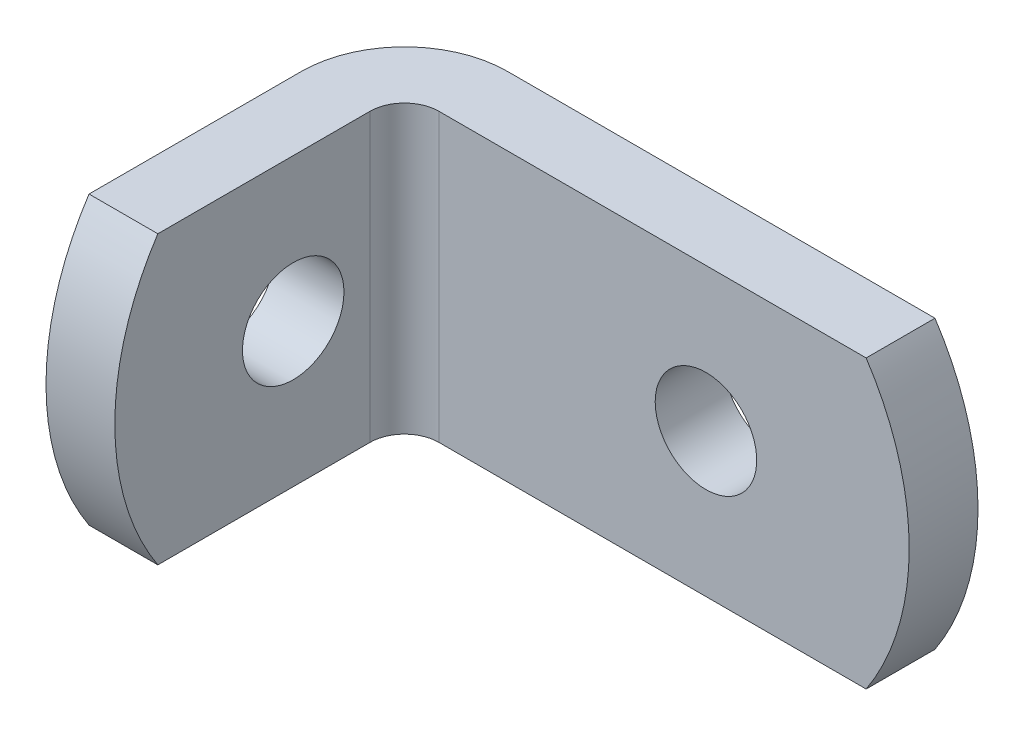
from build123d import *

# Parameters (mm, degrees)
EXTRUDE_THIN1_START     = -6.35
EXTRUDE_THIN1_DEPTH     = 12.7
SKETCH4_R               = 2.2479
EXTRUDE3_DEPTH          = 29.141606724
SKETCH6_R               = 2.2479
CUT_EXTRUDE1_DEPTH      = 31.618591166
CUT_EXTRUDE2_DEPTH      = 29.141606724
CUT_EXTRUDE2_DEPTH_BACK = 29.141606724
CUT_EXTRUDE3_DEPTH      = 31.618591166
CUT_EXTRUDE3_DEPTH_BACK = 31.618591166


# Read off the part's stored shape, not the designer's step: Extrude-Thin1
with BuildPart() as part:
    # Extrude-Thin1 outline → Extrude-Thin1 (new body)
    with BuildSketch(Plane(origin=(0, 0, 0), x_dir=(1, 0, 0), z_dir=(0, 1, 0)).offset(EXTRUDE_THIN1_START)):
        with BuildLine():
            Line((4.572, -3.048), (25.4, -3.048))
            Line((25.4, -3.048), (25.4, 0))
            Line((25.4, 0), (4.572, 0))
            ThreePointArc((4.572, 0), (1.339107796, -1.339107796), (0, -4.572))
            Line((0, -4.572), (0, -15.875))
            Line((0, -15.875), (3.048, -15.875))
            Line((3.048, -15.875), (3.048, -4.572))
            ThreePointArc((3.048, -4.572), (3.494369265, -3.494369265), (4.572, -3.048))
        make_face()
    extrude(amount=EXTRUDE_THIN1_DEPTH)

    # Sketch4 → Extrude3 (cut, through all)
    with BuildSketch(Plane(origin=(3.048, 0, 0), x_dir=(0, 0, -1), z_dir=(1, 0, 0))):
        with Locations((-7.975, 0)):
            Circle(SKETCH4_R)
    extrude(amount=-EXTRUDE3_DEPTH, mode=Mode.SUBTRACT)

    # Sketch6 → Cut-Extrude1 (cut, through all)
    with BuildSketch(Plane.XY):
        with Locations(Location((16.4, 0, 0), (0, 0, 180))):
            Circle(SKETCH6_R)
    extrude(amount=CUT_EXTRUDE1_DEPTH, mode=Mode.SUBTRACT)

    # Sketch8 → Cut-Extrude2 (cut, two sides: drawn at the far end of the back side and taken through both)
    with BuildSketch(Plane(origin=(3.048, 0, 0), x_dir=(0, 0, -1), z_dir=(1, 0, 0)).offset(-CUT_EXTRUDE2_DEPTH_BACK)):
        with BuildLine():
            Line((12.319806212, 46.222872755), (-13.97, 6.35))
            ThreePointArc((-13.97, 6.35), (-15.875, 0), (-13.97, -6.35))
            Line((-13.97, -6.35), (12.319806212, -46.222872755))
            Line((12.319806212, -46.222872755), (-83.199823025, -46.222872755))
            Line((-83.199823025, -46.222872755), (-83.199823025, 46.222872755))
            Line((-83.199823025, 46.222872755), (12.319806212, 46.222872755))
        make_face()
    extrude(amount=CUT_EXTRUDE2_DEPTH + CUT_EXTRUDE2_DEPTH_BACK, mode=Mode.SUBTRACT)

    # Sketch9 → Cut-Extrude3 (cut, two sides: drawn at the far end of the back side and taken through both)
    with BuildSketch(Plane.XY.offset(-CUT_EXTRUDE3_DEPTH_BACK)):
        with BuildLine():
            Line((-11.412637658, 59.293250448), (23.495, 6.35))
            ThreePointArc((23.495, 6.35), (25.4, 0), (23.495, -6.35))
            Line((23.495, -6.35), (-11.412637658, -59.293250448))
            Line((-11.412637658, -59.293250448), (115.418445833, -59.293250448))
            Line((115.418445833, -59.293250448), (115.418445833, 59.293250448))
            Line((115.418445833, 59.293250448), (-11.412637658, 59.293250448))
        make_face()
    extrude(amount=CUT_EXTRUDE3_DEPTH + CUT_EXTRUDE3_DEPTH_BACK, mode=Mode.SUBTRACT)


solid = part.part
